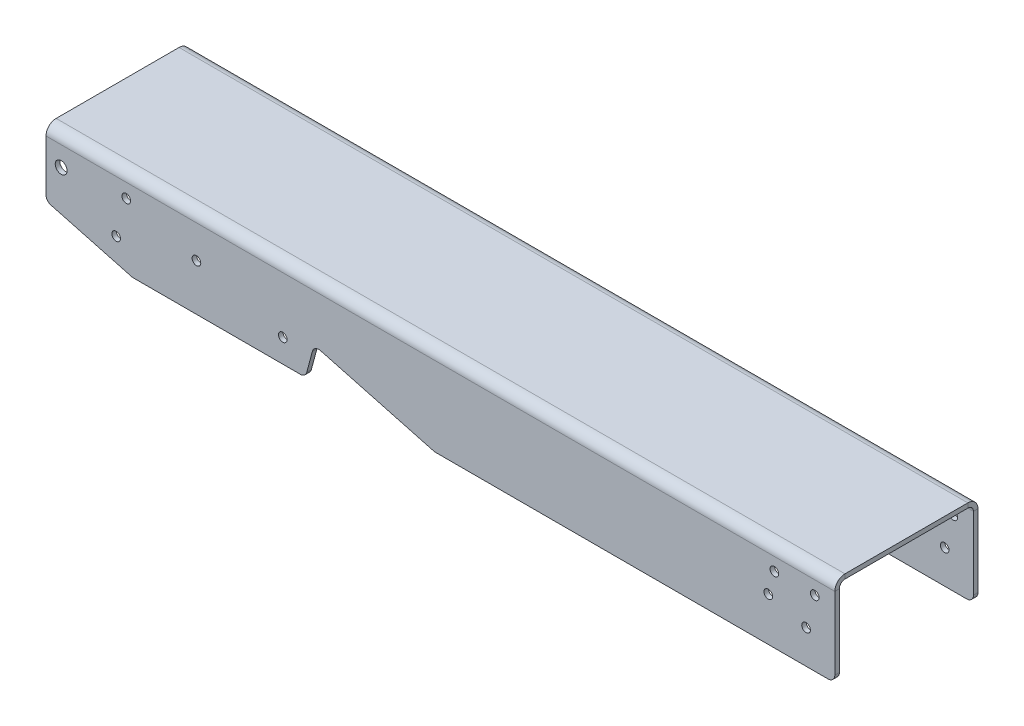
from build123d import *

# Parameters (mm, degrees)
BASE_FLANGE1_DEPTH           = 448.31
CUT_EXTRUDE1_DEPTH           = 459.458977562
F_1_4_CLEARANCE_HOLE1_D      = 6.7564
F_10_0_1935_DIAMETER_HOLE1_D = 4.9149
CUT_EXTRUDE2_DEPTH           = 459.458977562
FILLET1_R                    = 3.81


# Sheet-metal steps are written as plain solids
with BuildPart() as part:
    # Sketch2 → Base-Flange1 (new body)
    with BuildSketch(Plane(origin=(0, 0, 0), x_dir=(0, 0, -1), z_dir=(1, 0, 0))):
        with BuildLine():
            Line((-40.68826, -50.8), (-40.68826, -5.76326))
            ThreePointArc((-40.68826, -5.76326), (-39.000240228, -1.688019772), (-34.925, 0))
            Line((-34.925, 0), (34.925, 0))
            ThreePointArc((34.925, 0), (39.000240228, -1.688019772), (40.68826, -5.76326))
            Line((40.68826, -5.76326), (40.68826, -50.8))
            Line((40.68826, -50.8), (38.1, -50.8))
            Line((38.1, -50.8), (38.1, -5.76326))
            ThreePointArc((38.1, -5.76326), (37.17006403, -3.51819597), (34.925, -2.58826))
            Line((34.925, -2.58826), (-34.925, -2.58826))
            ThreePointArc((-34.925, -2.58826), (-37.17006403, -3.51819597), (-38.1, -5.76326))
            Line((-38.1, -5.76326), (-38.1, -50.8))
            Line((-38.1, -50.8), (-40.68826, -50.8))
        make_face()
    extrude(amount=BASE_FLANGE1_DEPTH)

    # Sketch8 → Cut-Extrude1 (cut, through all)
    with BuildSketch(Plane.XY.offset(40.68826)):
        Polygon((0, -37.636171444), (49.128076995, -50.8), (0, -50.8), align=None)
    extrude(amount=-CUT_EXTRUDE1_DEPTH, mode=Mode.SUBTRACT)

    # 1/4 Clearance Hole1 (through all)
    with Locations(Plane.XY.offset(40.68826)):
        with Locations((8.61046841, -16.934326391)):
            Hole(F_1_4_CLEARANCE_HOLE1_D / 2)

    # #10 (0.1935) Diameter Hole1 (through all)
    with Locations(Plane.XY.offset(40.68826)):
        with Locations((410.50096824, -26.010505082), (413.952320207, -13.129884188), (436.899172539, -13.361871369), (431.968669729, -31.762758359), (39.880176489, -35.174025037), (45.632429766, -13.706323547), (85.501018246, -24.389079634), (134.570050222, -37.537087125)):
            Hole(F_10_0_1935_DIAMETER_HOLE1_D / 2)

    # Sketch9 → Cut-Extrude2 (cut, through all)
    with BuildSketch(Plane.XY.offset(40.68826)):
        Polygon((140.864867564, -75.380798949), (152.369374119, -32.445395971), (220.869688909, -50.8), (209.365182354, -93.735402979), align=None)
    extrude(amount=-CUT_EXTRUDE2_DEPTH, mode=Mode.SUBTRACT)

    # Fillet1
    fillet1_edges = [part.edges().sort_by_distance(p)[0] for p in [
        (147.451272792, -50.8, -39.39413),
        (147.451272792, -50.8, 39.39413),
        (152.369374119, -32.445395971, -39.39413),
        (152.369374119, -32.445395971, 39.39413),
        (220.869688909, -50.8, -39.39413),
        (220.869688909, -50.8, 39.39413),
        (448.31, -50.8, 39.39413),
        (49.128076995, -50.8, -39.39413),
        (0, -37.636171444, -39.39413),
        (0, -37.636171444, 39.39413),
        (49.128076995, -50.8, 39.39413),
        (448.31, -50.8, -39.39413),
    ]]
    fillet(fillet1_edges, radius=FILLET1_R)


solid = part.part
